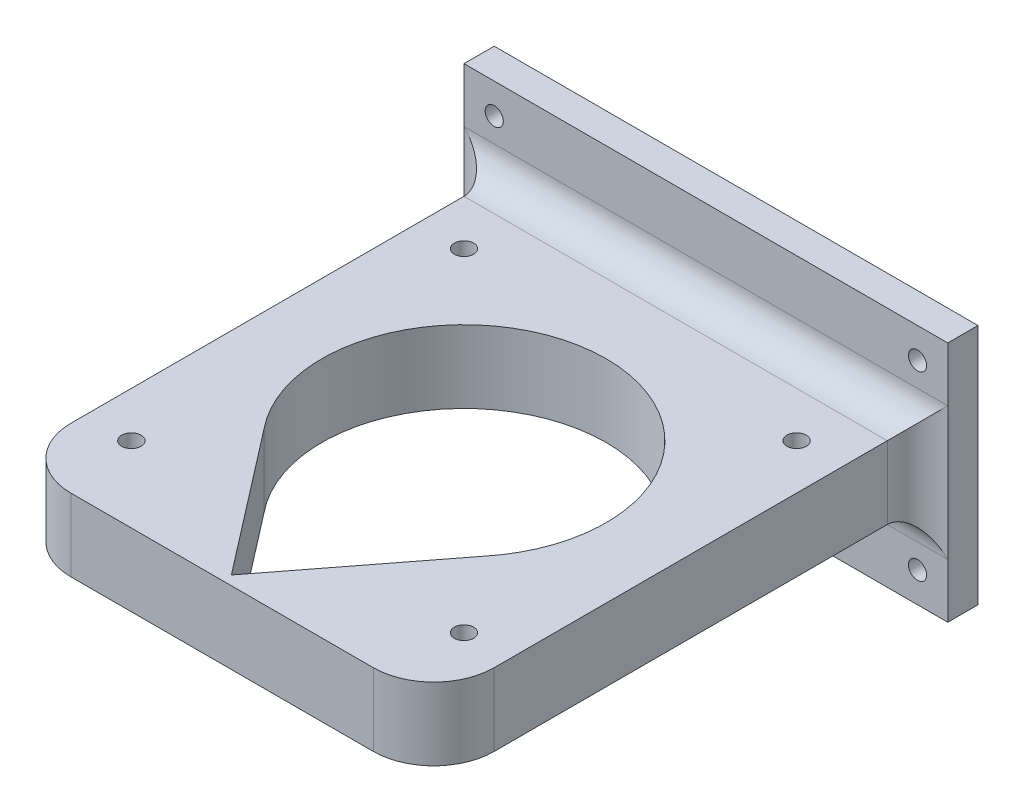
from build123d import *

# Parameters (mm, degrees)
SKETCH_2_W          = 70
SKETCH_2_H          = 80
SKETCH_2_R          = 23.5
SKETCH_2_R_2        = 1.6
EXTRUDE_4_DEPTH     = 12
SKETCH_6_W          = 80
SKETCH_6_H          = 40
EXTRUDE_6_DEPTH     = 5
FILLET_3_R          = 5
FILLET_4_R          = 5
FILLET_5_R          = 5
FILLET_6_R          = 5
SKETCH_7_R          = 1.5
CUT_EXTRUDE_4_DEPTH = 5
CUT_EXTRUDE_START   = -12
CUT_EXTRUDE_6_DEPTH = 12
FILLET_7_R          = 10
FILLET_8_R          = 10


with BuildPart() as part:
    # 草图2 → 凸台-拉伸4 (new body)
    with BuildSketch(Plane(origin=(0, 0, 0), x_dir=(1, 0, 0), z_dir=(0, 1, 0))):
        Rectangle(SKETCH_2_W, SKETCH_2_H)
        with Locations(Location((0, 0, 0), (0, 0, 270))):
            Circle(SKETCH_2_R, mode=Mode.SUBTRACT)
        with Locations(Location((-27.5, 27.5, 0), (0, 0, 270))):
            Circle(SKETCH_2_R_2, mode=Mode.SUBTRACT)
        with Locations(Location((27.5, 27.5, 0), (0, 0, 270))):
            Circle(SKETCH_2_R_2, mode=Mode.SUBTRACT)
        with Locations(Location((27.5, -27.5, 0), (0, 0, 270))):
            Circle(SKETCH_2_R_2, mode=Mode.SUBTRACT)
        with Locations(Location((-27.5, -27.5, 0), (0, 0, 270))):
            Circle(SKETCH_2_R_2, mode=Mode.SUBTRACT)
    extrude(amount=EXTRUDE_4_DEPTH)

    # 草图6 → 凸台-拉伸6 (add)
    with BuildSketch(Plane(origin=(0, 0, -40), x_dir=(-1, 0, 0), z_dir=(0, 0, -1))):
        with Locations((0, 6)):
            Rectangle(SKETCH_6_W, SKETCH_6_H)
    extrude(amount=EXTRUDE_6_DEPTH)

    # 圆角3
    fillet_3_edges = [part.edges().sort_by_distance(p)[0] for p in [
        (0, 12, -40),
    ]]
    fillet(fillet_3_edges, radius=FILLET_3_R)

    # 圆角4
    fillet_4_edges = [part.edges().sort_by_distance(p)[0] for p in [
        (0, 0, -40),
    ]]
    fillet(fillet_4_edges, radius=FILLET_4_R)

    # 圆角5
    fillet_5_edges = [part.edges().sort_by_distance(p)[0] for p in [
        (35, 6, -40),
    ]]
    fillet(fillet_5_edges, radius=FILLET_5_R - 0.0001)  # a hair under: the kernel refuses the full size

    # 圆角6
    fillet_6_edges = [part.edges().sort_by_distance(p)[0] for p in [
        (-35, 6, -40),
    ]]
    fillet(fillet_6_edges, radius=FILLET_6_R - 0.0001)  # a hair under: the kernel refuses the full size

    # 草图7 → 切除-拉伸4 (cut)
    with BuildSketch(Plane.XY.offset(-40)):
        with Locations((-35, -9)):
            Circle(SKETCH_7_R)
        with Locations(Location((-35, 21, 0), (0, 0, 180))):
            Circle(SKETCH_7_R)
        with Locations(Location((35, -9, 0), (0, 0, 180))):
            Circle(SKETCH_7_R)
        with Locations((35, 21)):
            Circle(SKETCH_7_R)
    extrude(amount=-CUT_EXTRUDE_4_DEPTH, mode=Mode.SUBTRACT)

    # 草图8 → 切除-拉伸6 (cut)
    with BuildSketch(Plane(origin=(0, 12, 0), x_dir=(1, 0, 0), z_dir=(0, 1, 0)).offset(CUT_EXTRUDE_START)):
        with BuildLine():
            Line((0, -38.461215902), (0, -23.5))
            ThreePointArc((0, -23.5), (-10.095935407, -21.220793771), (-18.233511761, -14.825284107))
            Line((-18.233511761, -14.825284107), (0, -38.461215902))
        make_face()
        with BuildLine():
            ThreePointArc((18.233511761, -14.825284107), (10.095935407, -21.220793771), (0, -23.5))
            Line((0, -23.5), (0, -38.461215902))
            Line((0, -38.461215902), (18.233511761, -14.825284107))
        make_face()
    extrude(amount=CUT_EXTRUDE_6_DEPTH, mode=Mode.SUBTRACT)

    # 圆角7
    fillet_7_edges = [part.edges().sort_by_distance(p)[0] for p in [
        (-35, 6, 40),
    ]]
    fillet(fillet_7_edges, radius=FILLET_7_R)

    # 圆角8
    fillet_8_edges = [part.edges().sort_by_distance(p)[0] for p in [
        (35, 6, 40),
    ]]
    fillet(fillet_8_edges, radius=FILLET_8_R)


solid = part.part
